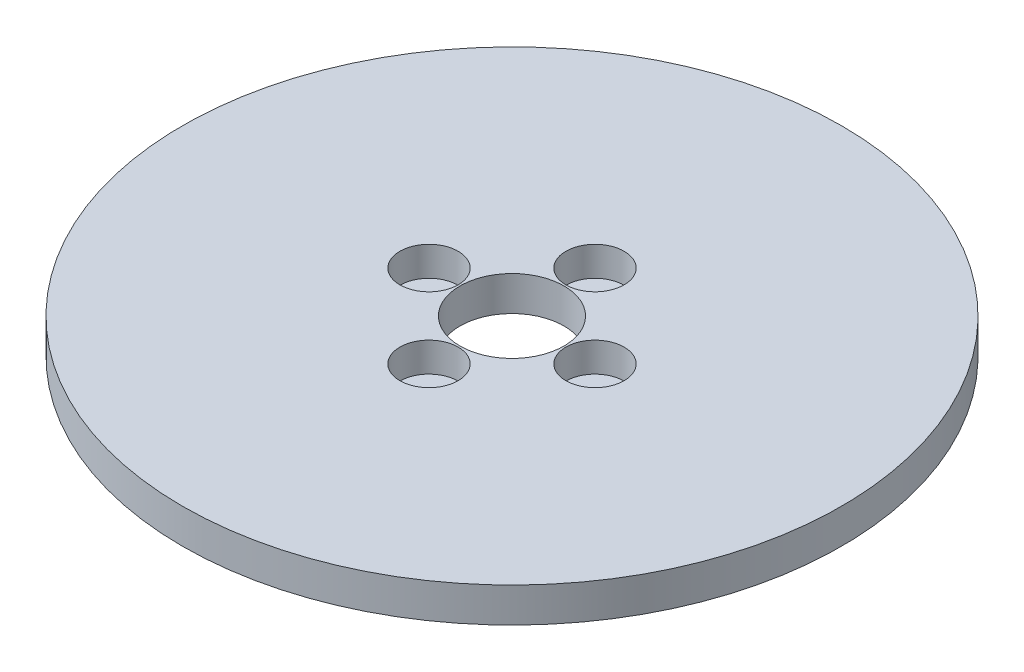
from build123d import *

# Parameters (mm, degrees)
SKETCH1_R           = 47.5
BOSS_EXTRUDE1_DEPTH = 5
SKETCH2_R           = 7.5
CUT_EXTRUDE1_DEPTH  = 68.360967927
SKETCH3_R           = 4.199430419
CUT_EXTRUDE2_DEPTH  = 4.245922325
CIRPATTERN1_COUNT   = 4


with BuildPart() as part:
    # Sketch1 → Boss-Extrude1 (new body)
    with BuildSketch(Plane(origin=(0, 0, 0), x_dir=(1, 0, 0), z_dir=(0, 1, 0))):
        Circle(SKETCH1_R)
    extrude(amount=BOSS_EXTRUDE1_DEPTH)

    # Sketch2 → Cut-Extrude1 (cut, through all)
    with BuildSketch(Plane(origin=(0, 0, 0), x_dir=(1, 0, 0), z_dir=(0, 1, 0))):
        Circle(SKETCH2_R)
    extrude(amount=CUT_EXTRUDE1_DEPTH, mode=Mode.SUBTRACT)

    # Sketch3 → Cut-Extrude2 (cut)
    with BuildSketch(Plane(origin=(0, 5, 0), x_dir=(1, 0, 0), z_dir=(0, 1, 0))):
        with Locations((-11.962121525, 0)):
            Circle(SKETCH3_R)
    cut_extrude2 = extrude(amount=-CUT_EXTRUDE2_DEPTH, mode=Mode.SUBTRACT)

    # CirPattern1: Cut-Extrude2 ×4 about axis
    cirpattern1_axis = Axis((0, 0, 0), (0, 1, 0))
    for i in range(1, CIRPATTERN1_COUNT):
        add(cut_extrude2.rotate(cirpattern1_axis, i * 360 / CIRPATTERN1_COUNT), mode=Mode.SUBTRACT)


solid = part.part
